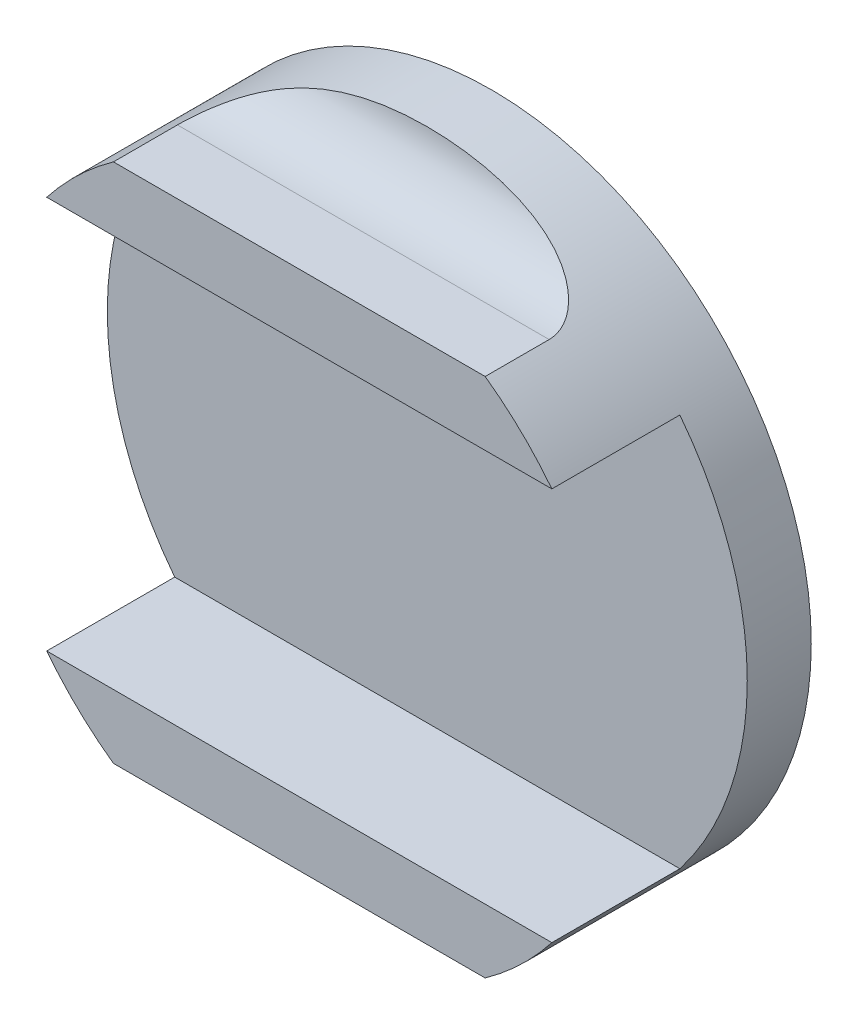
from build123d import *

# Parameters (mm, degrees)
ESQUISSE1_R        = 25
BOSS_EXTRU_1_DEPTH = 5
BOSS_EXTRU_2_DEPTH = 10
CONG_2_R           = 5


with BuildPart() as part:
    # Esquisse1 → Boss.-Extru.1 (new body)
    with BuildSketch(Plane.XY):
        Circle(ESQUISSE1_R)
    extrude(amount=BOSS_EXTRU_1_DEPTH)

    # Esquisse2 → Boss.-Extru.2 (add)
    with BuildSketch(Plane.XY.offset(5)):
        with BuildLine():
            Line((-19.732650608, 15.35), (19.732650608, 15.35))
            ThreePointArc((19.732650608, 15.35), (17.308633531, 18.039157555), (14.52162181, 20.35))
            Line((14.52162181, 20.35), (-14.52162181, 20.35))
            ThreePointArc((-14.52162181, 20.35), (-17.308633531, 18.039157555), (-19.732650608, 15.35))
        make_face()
        with BuildLine():
            Line((-14.52162181, -20.35), (14.52162181, -20.35))
            ThreePointArc((14.52162181, -20.35), (17.308633531, -18.039157555), (19.732650608, -15.35))
            Line((19.732650608, -15.35), (-19.732650608, -15.35))
            ThreePointArc((-19.732650608, -15.35), (-17.308633531, -18.039157555), (-14.52162181, -20.35))
        make_face()
    extrude(amount=BOSS_EXTRU_2_DEPTH)

    # Congé2
    # the kernel refuses this fillet: 5 mm, written as the material it adds along each edge
    with BuildSketch(Plane(origin=(27.02162181, 20.35, 5), x_dir=(0, 1, 0), z_dir=(-1, 0, 0))) as cong_2_piece_1_section:
        with BuildLine():
            CenterArc((CONG_2_R, -CONG_2_R), CONG_2_R, 90, 90)
            Line((0, -CONG_2_R), (0, 0))
            Line((0, 0), (CONG_2_R, 0))
        make_face()
    cong_2_piece_1 = extrude(amount=54.043243621, mode=Mode.PRIVATE)
    cong_2_piece_1 = cong_2_piece_1 & Plane(origin=(0, 0, 6.238001242), x_dir=(1, 0, 0), z_dir=(0, 0, -1)) * Cylinder(25, 129, mode=Mode.PRIVATE)
    add(cong_2_piece_1)
    with BuildSketch(Plane(origin=(-27.02162181, -20.35, 5), x_dir=(0, -1, 0), z_dir=(1, 0, 0))) as cong_2_piece_2_section:
        with BuildLine():
            CenterArc((CONG_2_R, -CONG_2_R), CONG_2_R, 90, 90)
            Line((0, -CONG_2_R), (0, 0))
            Line((0, 0), (CONG_2_R, 0))
        make_face()
    cong_2_piece_2 = extrude(amount=54.043243621, mode=Mode.PRIVATE)
    cong_2_piece_2 = cong_2_piece_2 & Plane(origin=(0, 0, 6.238012691), x_dir=(1, 0, 0), z_dir=(0, 0, -1)) * Cylinder(25, 129, mode=Mode.PRIVATE)
    add(cong_2_piece_2)


solid = part.part
